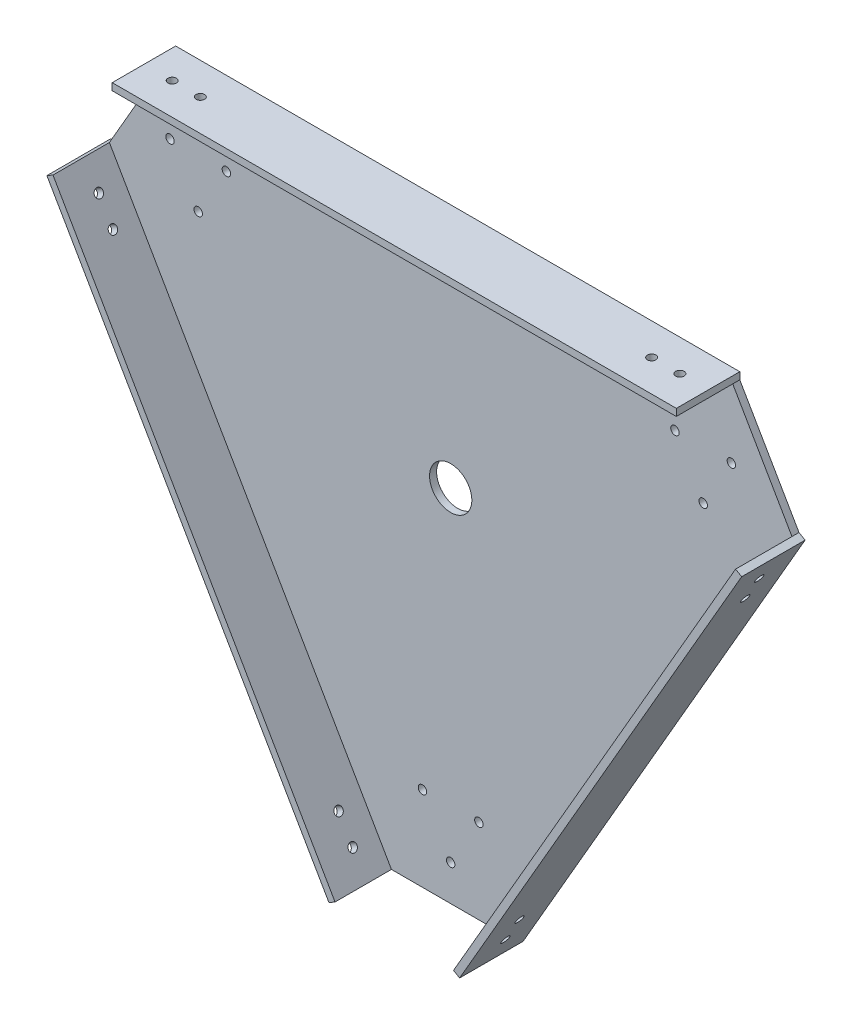
from build123d import *

# Parameters (mm, degrees)
SKETCH_1_R          = 1.5
SKETCH_1_R_2        = 7.5
EXTRUDE_1_DEPTH     = 2.5
SKETCH_2_W          = 200
SKETCH_2_H          = 2.5
EXTRUDE_2_DEPTH     = 22.5
CUT_EXTRUDE_1_REACH = 327.01
SKETCH_3_R          = 1.5
CUT_EXTRUDE_2_REACH = 238.725
SKETCH_6_R          = 1.5
CUT_EXTRUDE_3_REACH = 303.968
SKETCH_7_R          = 1.5


with BuildPart() as part:
    # Эскиз1 → Бобышка-Вытянуть1 (new body)
    with BuildSketch(Plane.XY):
        Polygon((0, 0), (21, 36.373066959), (221, 36.373066959), (242, 0), (142, -173.205080757), (100, -173.205080757), align=None)
        with Locations((21.48120212, 11.846533479)):
            Circle(SKETCH_1_R, mode=Mode.SUBTRACT)
        with Locations((41.48120212, 11.846533479)):
            Circle(SKETCH_1_R, mode=Mode.SUBTRACT)
        with Locations((31.48120212, -5.473974596)):
            Circle(SKETCH_1_R, mode=Mode.SUBTRACT)
        with Locations((200.51879788, 11.846533479)):
            Circle(SKETCH_1_R, mode=Mode.SUBTRACT)
        with Locations((220.51879788, 11.846533479)):
            Circle(SKETCH_1_R, mode=Mode.SUBTRACT)
        with Locations((210.51879788, -5.473974596)):
            Circle(SKETCH_1_R, mode=Mode.SUBTRACT)
        with Locations((111, -143.204572681)):
            Circle(SKETCH_1_R, mode=Mode.SUBTRACT)
        with Locations((131, -143.204572681)):
            Circle(SKETCH_1_R, mode=Mode.SUBTRACT)
        with Locations((121, -160.525080757)):
            Circle(SKETCH_1_R, mode=Mode.SUBTRACT)
        with Locations((121, -45.610671266)):
            Circle(SKETCH_1_R_2, mode=Mode.SUBTRACT)
    extrude(amount=EXTRUDE_1_DEPTH)

    # Эскиз2 → Бобышка-Вытянуть2 (add)
    with BuildSketch(Plane(origin=(0, 0, 0), x_dir=(-1, 0, 0), z_dir=(0, 0, -1))):
        Polygon((0, 0), (2.165063509, -1.25), (-97.834936491, -174.455080757), (-100, -173.205080757), align=None)
        with Locations((-121, 37.623066959)):
            Rectangle(SKETCH_2_W, SKETCH_2_H)
        Polygon((-242, 0), (-244.165063509, -1.25), (-144.165063509, -174.455080757), (-142, -173.205080757), align=None)
    extrude(amount=-EXTRUDE_2_DEPTH)

    # Эскиз3 → Вырез-Вытянуть1 (cut, up to next)
    with BuildSketch(Plane(origin=(0, 38.873066959, 0), x_dir=(1, 0, 0), z_dir=(0, 1, 0)), mode=Mode.PRIVATE) as cut_extrude_1_sk1:
        with Locations((211, -11.25)):
            Circle(SKETCH_3_R)
    cut_extrude_1_tool1 = extrude(cut_extrude_1_sk1.sketch, amount=-CUT_EXTRUDE_1_REACH, mode=Mode.PRIVATE) & part.part
    # Эскиз3 → Вырез-Вытянуть1 (cut, up to next)
    with BuildSketch(Plane(origin=(0, 38.873066959, 0), x_dir=(1, 0, 0), z_dir=(0, 1, 0)), mode=Mode.PRIVATE) as cut_extrude_1_sk2:
        with Locations((201, -11.25)):
            Circle(SKETCH_3_R)
    cut_extrude_1_tool2 = extrude(cut_extrude_1_sk2.sketch, amount=-CUT_EXTRUDE_1_REACH, mode=Mode.PRIVATE) & part.part
    # Эскиз3 → Вырез-Вытянуть1 (cut, up to next)
    with BuildSketch(Plane(origin=(0, 38.873066959, 0), x_dir=(1, 0, 0), z_dir=(0, 1, 0)), mode=Mode.PRIVATE) as cut_extrude_1_sk3:
        with Locations((41, -11.25)):
            Circle(SKETCH_3_R)
    cut_extrude_1_tool3 = extrude(cut_extrude_1_sk3.sketch, amount=-CUT_EXTRUDE_1_REACH, mode=Mode.PRIVATE) & part.part
    # Эскиз3 → Вырез-Вытянуть1 (cut, up to next)
    with BuildSketch(Plane(origin=(0, 38.873066959, 0), x_dir=(1, 0, 0), z_dir=(0, 1, 0)), mode=Mode.PRIVATE) as cut_extrude_1_sk4:
        with Locations((31, -11.25)):
            Circle(SKETCH_3_R)
    cut_extrude_1_tool4 = extrude(cut_extrude_1_sk4.sketch, amount=-CUT_EXTRUDE_1_REACH, mode=Mode.PRIVATE) & part.part
    add(cut_extrude_1_tool1.solids().sort_by_distance((211, 38.873067, 11.25))[0], mode=Mode.SUBTRACT)
    add(cut_extrude_1_tool2.solids().sort_by_distance((201, 38.873067, 11.25))[0], mode=Mode.SUBTRACT)
    add(cut_extrude_1_tool3.solids().sort_by_distance((41, 38.873067, 11.25))[0], mode=Mode.SUBTRACT)
    add(cut_extrude_1_tool4.solids().sort_by_distance((31, 38.873067, 11.25))[0], mode=Mode.SUBTRACT)

    # Эскиз6 → Вырез-Вытянуть2 (cut, up to next)
    with BuildSketch(Plane(origin=(183.665063509, -106.039073858, 0), x_dir=(0, 0, -1), z_dir=(0.8660254037844386, -0.5000000000000003, 0)), mode=Mode.PRIVATE) as cut_extrude_2_sk1:
        with Locations((-11.25, 111)):
            Circle(SKETCH_6_R)
    cut_extrude_2_tool1 = extrude(cut_extrude_2_sk1.sketch, amount=-CUT_EXTRUDE_2_REACH, mode=Mode.PRIVATE) & part.part
    # Эскиз6 → Вырез-Вытянуть2 (cut, up to next)
    with BuildSketch(Plane(origin=(183.665063509, -106.039073858, 0), x_dir=(0, 0, -1), z_dir=(0.8660254037844386, -0.5000000000000003, 0)), mode=Mode.PRIVATE) as cut_extrude_2_sk2:
        with Locations((-11.25, 101)):
            Circle(SKETCH_6_R)
    cut_extrude_2_tool2 = extrude(cut_extrude_2_sk2.sketch, amount=-CUT_EXTRUDE_2_REACH, mode=Mode.PRIVATE) & part.part
    # Эскиз6 → Вырез-Вытянуть2 (cut, up to next)
    with BuildSketch(Plane(origin=(183.665063509, -106.039073858, 0), x_dir=(0, 0, -1), z_dir=(0.8660254037844386, -0.5000000000000003, 0)), mode=Mode.PRIVATE) as cut_extrude_2_sk3:
        with Locations((-11.25, -59)):
            Circle(SKETCH_6_R)
    cut_extrude_2_tool3 = extrude(cut_extrude_2_sk3.sketch, amount=-CUT_EXTRUDE_2_REACH, mode=Mode.PRIVATE) & part.part
    # Эскиз6 → Вырез-Вытянуть2 (cut, up to next)
    with BuildSketch(Plane(origin=(183.665063509, -106.039073858, 0), x_dir=(0, 0, -1), z_dir=(0.8660254037844386, -0.5000000000000003, 0)), mode=Mode.PRIVATE) as cut_extrude_2_sk4:
        with Locations((-11.25, -69)):
            Circle(SKETCH_6_R)
    cut_extrude_2_tool4 = extrude(cut_extrude_2_sk4.sketch, amount=-CUT_EXTRUDE_2_REACH, mode=Mode.PRIVATE) & part.part
    add(cut_extrude_2_tool1.solids().sort_by_distance((239.165064, -9.910254, 11.25))[0], mode=Mode.SUBTRACT)
    add(cut_extrude_2_tool2.solids().sort_by_distance((234.165064, -18.570508, 11.25))[0], mode=Mode.SUBTRACT)
    add(cut_extrude_2_tool3.solids().sort_by_distance((154.165064, -157.134573, 11.25))[0], mode=Mode.SUBTRACT)
    add(cut_extrude_2_tool4.solids().sort_by_distance((149.165064, -165.794827, 11.25))[0], mode=Mode.SUBTRACT)

    # Эскиз7 → Вырез-Вытянуть3 (cut, up to next)
    with BuildSketch(Plane(origin=(-2.165063509, -1.25, 0), x_dir=(0, 0, 1), z_dir=(-0.8660254037844386, -0.5000000000000003, 0)), mode=Mode.PRIVATE) as cut_extrude_3_sk1:
        with Locations((11.25, -10)):
            Circle(SKETCH_7_R)
    cut_extrude_3_tool1 = extrude(cut_extrude_3_sk1.sketch, amount=-CUT_EXTRUDE_3_REACH, mode=Mode.PRIVATE) & part.part
    # Эскиз7 → Вырез-Вытянуть3 (cut, up to next)
    with BuildSketch(Plane(origin=(-2.165063509, -1.25, 0), x_dir=(0, 0, 1), z_dir=(-0.8660254037844386, -0.5000000000000003, 0)), mode=Mode.PRIVATE) as cut_extrude_3_sk2:
        with Locations((11.25, -20)):
            Circle(SKETCH_7_R)
    cut_extrude_3_tool2 = extrude(cut_extrude_3_sk2.sketch, amount=-CUT_EXTRUDE_3_REACH, mode=Mode.PRIVATE) & part.part
    # Эскиз7 → Вырез-Вытянуть3 (cut, up to next)
    with BuildSketch(Plane(origin=(-2.165063509, -1.25, 0), x_dir=(0, 0, 1), z_dir=(-0.8660254037844386, -0.5000000000000003, 0)), mode=Mode.PRIVATE) as cut_extrude_3_sk3:
        with Locations((11.25, -180)):
            Circle(SKETCH_7_R)
    cut_extrude_3_tool3 = extrude(cut_extrude_3_sk3.sketch, amount=-CUT_EXTRUDE_3_REACH, mode=Mode.PRIVATE) & part.part
    # Эскиз7 → Вырез-Вытянуть3 (cut, up to next)
    with BuildSketch(Plane(origin=(-2.165063509, -1.25, 0), x_dir=(0, 0, 1), z_dir=(-0.8660254037844386, -0.5000000000000003, 0)), mode=Mode.PRIVATE) as cut_extrude_3_sk4:
        with Locations((11.25, -190)):
            Circle(SKETCH_7_R)
    cut_extrude_3_tool4 = extrude(cut_extrude_3_sk4.sketch, amount=-CUT_EXTRUDE_3_REACH, mode=Mode.PRIVATE) & part.part
    add(cut_extrude_3_tool1.solids().sort_by_distance((2.834936, -9.910254, 11.25))[0], mode=Mode.SUBTRACT)
    add(cut_extrude_3_tool2.solids().sort_by_distance((7.834936, -18.570508, 11.25))[0], mode=Mode.SUBTRACT)
    add(cut_extrude_3_tool3.solids().sort_by_distance((87.834936, -157.134573, 11.25))[0], mode=Mode.SUBTRACT)
    add(cut_extrude_3_tool4.solids().sort_by_distance((92.834936, -165.794827, 11.25))[0], mode=Mode.SUBTRACT)


solid = part.part
